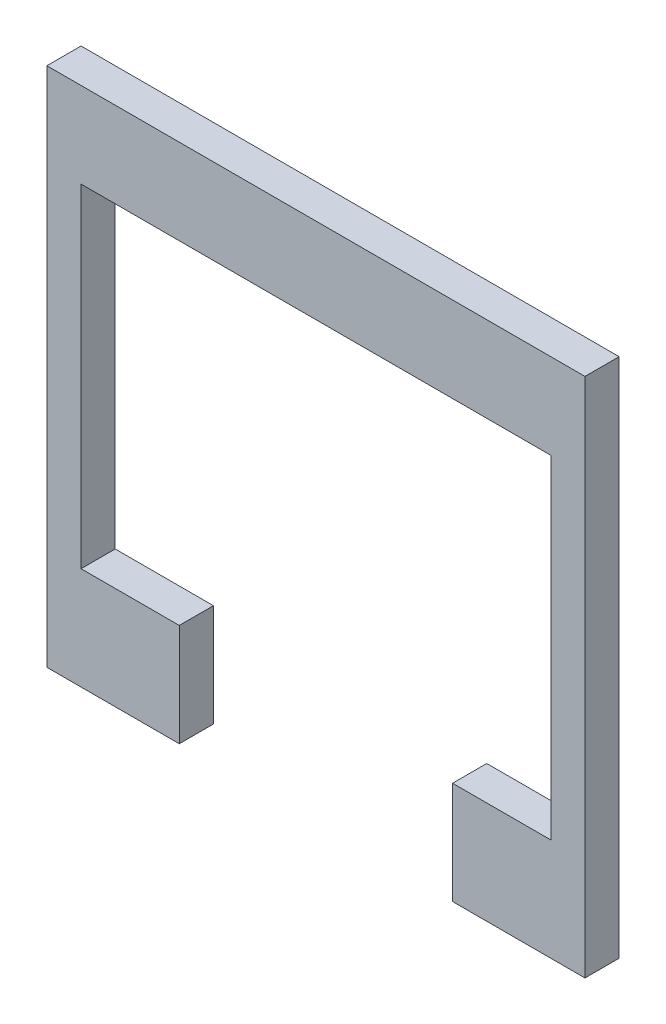
from build123d import *

# Parameters (mm, degrees)
SALIENTE_EXTRUIR1_DEPTH = 2


with BuildPart() as part:
    # Croquis4 → Saliente-Extruir1 (new body)
    with BuildSketch(Plane.XY):
        Polygon((-13.75, -11.25), (-8, -11.25), (-8, -17.25), (-15.75, -17.25), (-15.75, 13.25), (15.75, 13.25), (15.75, -17.25), (8, -17.25), (8, -11.25), (13.75, -11.25), (13.75, 8.25), (-13.75, 8.25), align=None)
    extrude(amount=SALIENTE_EXTRUIR1_DEPTH)


solid = part.part
